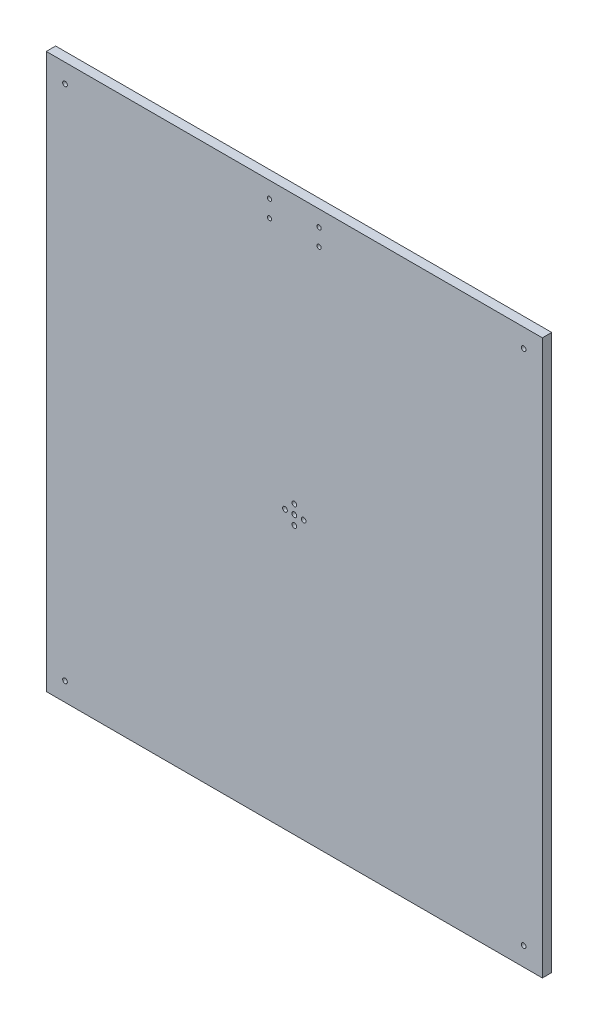
from build123d import *

# Parameters (mm, degrees)
SKETCH_3_W                  = 530
SKETCH_3_H                  = 592.3
SKETCH_3_R                  = 2.55
EXTRUDE_1_DEPTH             = 10
SKETCH_4_R                  = 2.5
CUT_EXTRUDE_1_DEPTH         = 398.529649838
PATTERN_LINEAR_1_COUNT      = 2
PATTERN_LINEAR_1_PITCH      = 490
PATTERN_LINEAR_1_COUNT_DIR2 = 2
PATTERN_LINEAR_1_PITCH_DIR2 = 552.3
SKETCH_7_R                  = 2.25
CUT_EXTRUDE_2_DEPTH         = 398.529649838


with BuildPart() as part:
    # Эскиз3 → Бобышка-Вытянуть1 (new body)
    with BuildSketch(Plane.XY):
        Rectangle(SKETCH_3_W, SKETCH_3_H)
        Circle(SKETCH_3_R, mode=Mode.SUBTRACT)
        with Locations((0, 10)):
            Circle(SKETCH_3_R, mode=Mode.SUBTRACT)
        with Locations((10, 0)):
            Circle(SKETCH_3_R, mode=Mode.SUBTRACT)
        with Locations((0, -10)):
            Circle(SKETCH_3_R, mode=Mode.SUBTRACT)
        with Locations((-10, 0)):
            Circle(SKETCH_3_R, mode=Mode.SUBTRACT)
    extrude(amount=EXTRUDE_1_DEPTH)

    # Эскиз4 → Вырез-Вытянуть1 (cut, through all)
    with BuildSketch(Plane.XY.offset(10)):
        with Locations((-245, 276.15)):
            Circle(SKETCH_4_R)
    cut_extrude_1 = extrude(amount=-CUT_EXTRUDE_1_DEPTH, mode=Mode.SUBTRACT)

    # Линейный массив1: Cut-Extrude 1 2 × 2
    with Locations(*[(i * PATTERN_LINEAR_1_PITCH, -j * PATTERN_LINEAR_1_PITCH_DIR2, 0) for i in range(PATTERN_LINEAR_1_COUNT) for j in range(PATTERN_LINEAR_1_COUNT_DIR2) if (i, j) != (0, 0)]):
        add(cut_extrude_1, mode=Mode.SUBTRACT)

    # Эскиз7 → Вырез-Вытянуть2 (cut, through all)
    with BuildSketch(Plane(origin=(0, 0, 0), x_dir=(-1, 0, 0), z_dir=(0, 0, -1))):
        with Locations((-26.5, 279.15)):
            Circle(SKETCH_7_R)
        with Locations((26.5, 279.15)):
            Circle(SKETCH_7_R)
        with Locations((-26.5, 261.15)):
            Circle(SKETCH_7_R)
        with Locations((26.5, 261.15)):
            Circle(SKETCH_7_R)
    extrude(amount=-CUT_EXTRUDE_2_DEPTH, mode=Mode.SUBTRACT)


solid = part.part
